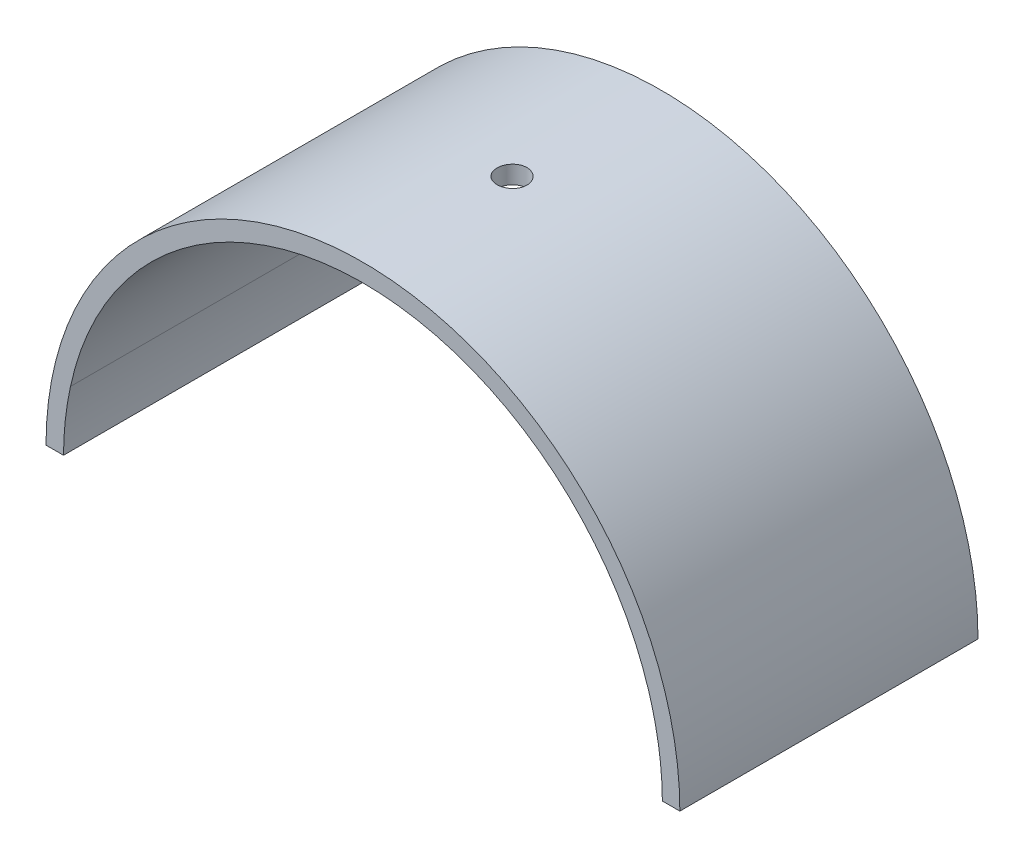
from build123d import *

# Parameters (mm, degrees)
BOSS_EXTRUDE1_DEPTH      = 15
BOSS_EXTRUDE2_DEPTH      = 15
F_3_0_3_DIAMETER_HOLE1_D = 3


with BuildPart() as part:
    # Sketch1 → Boss-Extrude1 (new, symmetric)
    with BuildSketch(Plane.XY):
        with BuildLine():
            Line((-31.891178344, 0), (-30.472178344, 0))
            ThreePointArc((-30.472178344, 0), (0, 30.472178344), (30.472178344, 0))
            Line((30.472178344, 0), (31.891178344, 0))
            ThreePointArc((31.891178344, 0), (0, 31.891178344), (-31.891178344, 0))
        make_face()
    extrude(amount=BOSS_EXTRUDE1_DEPTH, both=True)

    # Sketch2 → Boss-Extrude2 (add, symmetric)
    with BuildSketch(Plane.XY):
        with BuildLine():
            Line((-30.129278344, 0), (-30.472178344, 0))
            ThreePointArc((-30.472178344, 0), (0, 30.472178344), (30.472178344, 0))
            Line((30.472178344, 0), (30.129278344, 0))
            ThreePointArc((30.129278344, 0), (29.947091618, 3.193657531), (29.427339134, 6.35))
            add(Edge.make_bspline(
                [(29.427339134, 6.35), (24.299524612, 30.091178344), (0, 30.091178344), (-24.299524612, 30.091178344), (-29.427339134, 6.35)],
                knots=[0.212623764, 0.212623764, 0.212623764, 1.570796327, 1.570796327, 2.928968889, 2.928968889, 2.928968889], degree=2, weights=[1, 0.778146934, 1, 0.778146934, 1]))
            ThreePointArc((-29.427339134, 6.35), (-29.947091618, 3.193657531), (-30.129278344, 0))
        make_face()
    extrude(amount=BOSS_EXTRUDE2_DEPTH, both=True)

    # Ø3.0 (3) Diameter Hole1 (through all)
    with Locations(Plane(origin=(0, 31.891178344, 0), x_dir=(1, 0, 0), z_dir=(0, 1, 0))):
        with Locations((0, 0)):
            Hole(F_3_0_3_DIAMETER_HOLE1_D / 2)


solid = part.part
